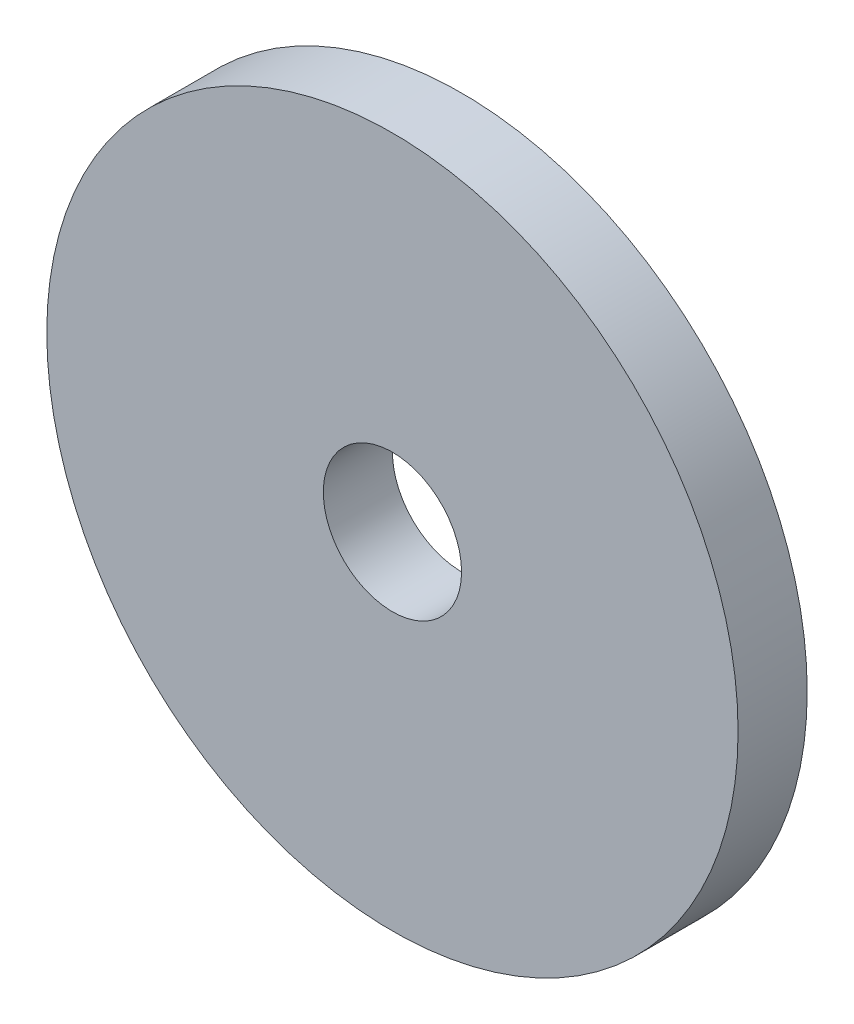
from build123d import *

# Parameters (mm, degrees)
SKETCH_1_R      = 10
SKETCH_1_R_2    = 2
EXTRUDE_1_DEPTH = 2


with BuildPart() as part:
    # Эскиз1 → Бобышка-Вытянуть1 (new body)
    with BuildSketch(Plane.XY):
        Circle(SKETCH_1_R)
        Circle(SKETCH_1_R_2, mode=Mode.SUBTRACT)
    extrude(amount=EXTRUDE_1_DEPTH)


solid = part.part
